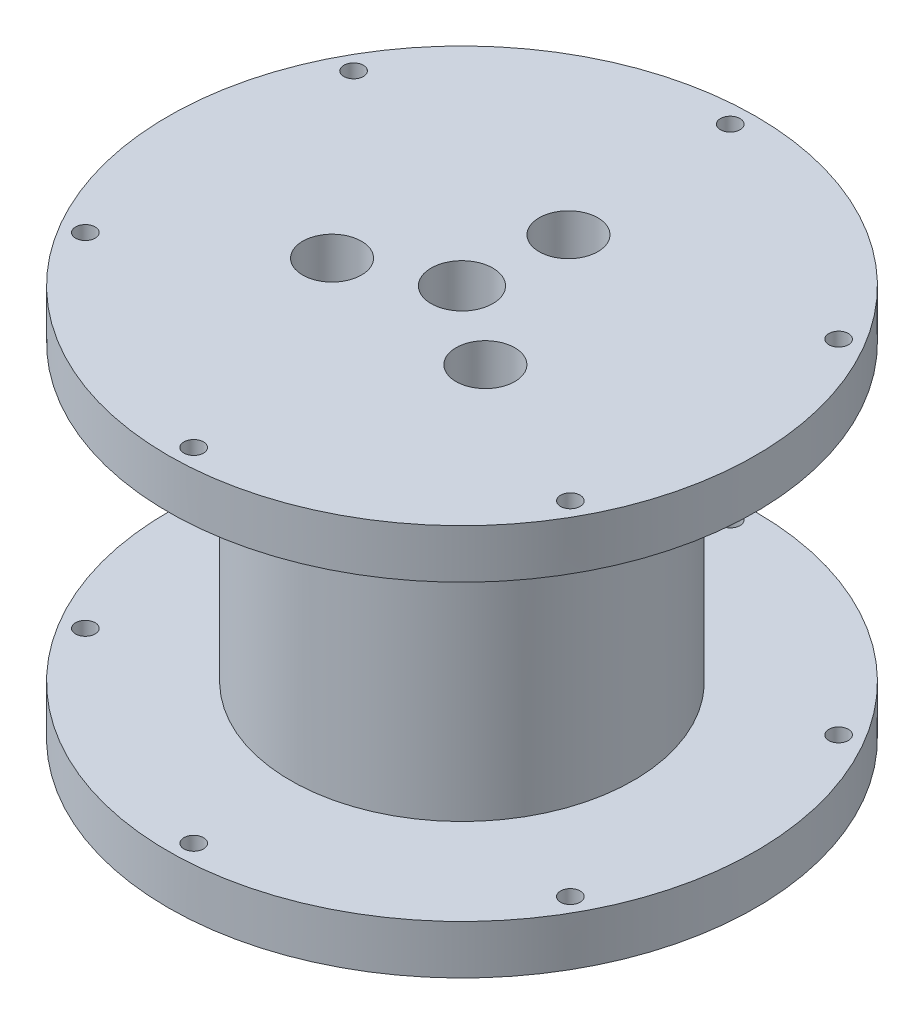
from build123d import *

# Parameters (mm, degrees)
SKETCH1_R               = 30
BOSS_EXTRUDE1_DEPTH     = 40
CUT_EXTRUDE1_START      = -5
SKETCH2_OUTSIDE_W       = 80.762
SKETCH2_OUTSIDE_H       = 80.762
SKETCH2_OUTSIDE_R       = 17.5
CUT_EXTRUDE1_DEPTH      = 30
SKETCH3_R               = 3.15
CUT_EXTRUDE2_DEPTH      = 59.309518948
CUT_EXTRUDE3_DEPTH      = 59.309518948
CUT_EXTRUDE4_REACH      = 60
CUT_EXTRUDE4_START      = 3
SKETCH5_R               = 2
CUT_EXTRUDE5_DEPTH      = 7.5
FILLET1_R               = 2
CUT_EXTRUDE6_DEPTH      = 59.309518948
CUT_EXTRUDE6_DEPTH_BACK = 59.309518948


with BuildPart() as part:
    # Sketch1 → Boss-Extrude1 (new body)
    with BuildSketch(Plane(origin=(0, 0, 0), x_dir=(1, 0, 0), z_dir=(0, 1, 0))):
        with Locations(Location((0, 0, 0), (0, 0, 270))):
            Circle(SKETCH1_R)
    extrude(amount=BOSS_EXTRUDE1_DEPTH)

    # Sketch2 outside → Cut-Extrude1 (cut)
    with BuildSketch(Plane.XZ.offset(CUT_EXTRUDE1_START)):
        Rectangle(SKETCH2_OUTSIDE_W, SKETCH2_OUTSIDE_H)
        with Locations(Location((0, 0, 0), (0, 0, 270))):
            Circle(SKETCH2_OUTSIDE_R, mode=Mode.SUBTRACT)
    extrude(amount=-CUT_EXTRUDE1_DEPTH, mode=Mode.SUBTRACT)

    # Sketch3 → Cut-Extrude2 (cut, through all)
    with BuildSketch(Plane.XZ):
        with Locations(Location((0, 0, 0), (0, 0, 270))):
            Circle(SKETCH3_R)
    extrude(amount=-CUT_EXTRUDE2_DEPTH, mode=Mode.SUBTRACT)

    # Sketch4 → Cut-Extrude3 (cut, through all)
    with BuildSketch(Plane.XZ):
        with BuildLine():
            ThreePointArc((3.905730858, -9.682213924), (0.642886859, -6.970415804), (-2.06891126, -10.233259803))
            Line((-2.06891126, -10.233259803), (3.905730858, -9.682213924))
        make_face()
        with BuildLine():
            Line((3.905730858, -9.682213924), (-2.06891126, -10.233259803))
            ThreePointArc((-2.06891126, -10.233259803), (1.056317055, -12.954565452), (3.918409799, -9.957736863))
            ThreePointArc((3.918409799, -9.957736863), (3.915238387, -9.819829607), (3.905730858, -9.682213924))
        make_face()
        with BuildLine():
            ThreePointArc((6.432177794, 8.223569105), (5.715113732, 4.041964254), (9.896718583, 3.324900192))
            Line((9.896718583, 3.324900192), (6.432177794, 8.223569105))
        make_face()
        with BuildLine():
            Line((6.432177794, 8.223569105), (9.896718583, 3.324900192))
            ThreePointArc((9.896718583, 3.324900192), (10.828731505, 4.395251542), (11.164448189, 5.774234649))
            ThreePointArc((11.164448189, 5.774234649), (9.543431295, 8.438517965), (6.432177794, 8.223569105))
        make_face()
        with BuildLine():
            ThreePointArc((-7.827807323, 6.908359611), (-11.807715384, 5.438552879), (-10.337908652, 1.458644819))
            Line((-10.337908652, 1.458644819), (-7.827807323, 6.908359611))
        make_face()
        with BuildLine():
            Line((-7.827807323, 6.908359611), (-10.337908652, 1.458644819))
            ThreePointArc((-10.337908652, 1.458644819), (-7.465012505, 1.657126155), (-6.082857987, 4.183502215))
            ThreePointArc((-6.082857987, 4.183502215), (-6.556481927, 5.801347697), (-7.827807323, 6.908359611))
        make_face()
    extrude(amount=-CUT_EXTRUDE3_DEPTH, mode=Mode.SUBTRACT)

    # Sketch5 → Cut-Extrude4 (cut, up to next)
    with BuildSketch(Plane(origin=(0, 5, 0), x_dir=(1, 0, 0), z_dir=(0, 1, 0)).offset(CUT_EXTRUDE4_START), mode=Mode.PRIVATE) as cut_extrude4_sk1:
        with Locations(Location((-15.339737127, 8.422734999, 0), (0, 0, 270))):
            Circle(SKETCH5_R)
    cut_extrude4_tool1 = extrude(cut_extrude4_sk1.sketch, amount=-CUT_EXTRUDE4_REACH, mode=Mode.PRIVATE) & part.part
    add(cut_extrude4_tool1.solids().sort_by_distance((-15.339737, 8, -8.422735))[0], mode=Mode.SUBTRACT)

    # Sketch6 → Cut-Extrude5 (cut)
    with BuildSketch(Plane.XZ):
        Polygon((-6.062177826, 0), (-3.031088913, -5.25), (3.031088913, -5.25), (6.062177826, 0), (3.031088913, 5.25), (-3.031088913, 5.25), align=None)
    extrude(amount=-CUT_EXTRUDE5_DEPTH, mode=Mode.SUBTRACT)

    # Fillet1
    fillet1_edges = [part.edges().sort_by_distance(p)[0] for p in [
        (-13.417435738, 8, -7.870686661),
    ]]
    fillet(fillet1_edges, radius=FILLET1_R - 0.0001)  # a hair under: the kernel refuses the full size

    # Sketch7 → Cut-Extrude6 (cut, two sides: drawn at the far end of the back side and taken through both)
    with BuildSketch(Plane(origin=(0, 0, 0), x_dir=(-1, 0, 0), z_dir=(0, -1, 0)).offset(-CUT_EXTRUDE6_DEPTH_BACK)):
        with BuildLine():
            Line((-24.522118485, -12.47660631), (-24.543579404, -13.476375998))
            Line((-24.543579404, -13.476375998), (-23.688483916, -13.994846544))
            ThreePointArc((-23.688483916, -13.994846544), (-23.580486602, -13.745545566), (-23.543579404, -13.476375998))
            ThreePointArc((-23.543579404, -13.476375998), (-23.82892532, -12.77689795), (-24.522118485, -12.47660631))
        make_face()
        with BuildLine():
            Line((-23.688483916, -13.994846544), (-24.543579404, -13.476375998))
            Line((-24.543579404, -13.476375998), (-24.522118485, -12.47660631))
            ThreePointArc((-24.522118485, -12.47660631), (-25.420135811, -13.957675141), (-23.688483916, -13.994846544))
        make_face()
        with BuildLine():
            ThreePointArc((0.275650671, -27.51225212), (-0.579444817, -26.993781575), (-1.456001224, -27.475080718))
            Line((-1.456001224, -27.475080718), (-0.600905736, -27.993551263))
            Line((-0.600905736, -27.993551263), (0.275650671, -27.51225212))
        make_face()
        with BuildLine():
            Line((-0.600905736, -27.993551263), (-1.456001224, -27.475080718))
            ThreePointArc((-1.456001224, -27.475080718), (-0.870075304, -28.956644064), (0.399094264, -27.993551263))
            ThreePointArc((0.399094264, -27.993551263), (0.36774188, -27.745112545), (0.275650671, -27.51225212))
            Line((0.275650671, -27.51225212), (-0.600905736, -27.993551263))
        make_face()
        with BuildLine():
            ThreePointArc((23.964134587, -13.517405576), (23.087578179, -13.998704719), (23.06611726, -14.998474407))
            Line((23.06611726, -14.998474407), (23.942673667, -14.517175264))
            Line((23.942673667, -14.517175264), (23.964134587, -13.517405576))
        make_face()
        with BuildLine():
            Line((23.942673667, -14.517175264), (23.06611726, -14.998474407))
            ThreePointArc((23.06611726, -14.998474407), (24.191112385, -15.48582288), (24.942673667, -14.517175264))
            ThreePointArc((24.942673667, -14.517175264), (24.657327751, -13.817697216), (23.964134587, -13.517405576))
            Line((23.964134587, -13.517405576), (23.942673667, -14.517175264))
        make_face()
        with BuildLine():
            ThreePointArc((23.688483916, 13.994846544), (23.667022996, 12.995076856), (24.522118485, 12.47660631))
            Line((24.522118485, 12.47660631), (24.543579404, 13.476375998))
            Line((24.543579404, 13.476375998), (23.688483916, 13.994846544))
        make_face()
        with BuildLine():
            Line((24.543579404, 13.476375998), (24.522118485, 12.47660631))
            ThreePointArc((24.522118485, 12.47660631), (25.243057452, 12.761721915), (25.543579404, 13.476375998))
            ThreePointArc((25.543579404, 13.476375998), (24.812748971, 14.4394688), (23.688483916, 13.994846544))
            Line((23.688483916, 13.994846544), (24.543579404, 13.476375998))
        make_face()
        with BuildLine():
            ThreePointArc((1.600905736, 27.993551263), (0.352467019, 28.962198878), (-0.275650671, 27.51225212))
            Line((-0.275650671, 27.51225212), (0.600905736, 27.993551263))
            Line((0.600905736, 27.993551263), (1.456001224, 27.475080718))
            ThreePointArc((1.456001224, 27.475080718), (1.563998538, 27.724381695), (1.600905736, 27.993551263))
        make_face()
        with BuildLine():
            Line((0.600905736, 27.993551263), (-0.275650671, 27.51225212))
            ThreePointArc((-0.275650671, 27.51225212), (0.579444817, 26.993781575), (1.456001224, 27.475080718))
            Line((1.456001224, 27.475080718), (0.600905736, 27.993551263))
        make_face()
        with BuildLine():
            ThreePointArc((-23.06611726, 14.998474407), (-24.797769156, 15.035645809), (-23.964134587, 13.517405576))
            Line((-23.964134587, 13.517405576), (-23.942673667, 14.517175264))
            Line((-23.942673667, 14.517175264), (-23.06611726, 14.998474407))
        make_face()
        with BuildLine():
            Line((-23.942673667, 14.517175264), (-23.964134587, 13.517405576))
            ThreePointArc((-23.964134587, 13.517405576), (-23.243195619, 13.80252118), (-22.942673667, 14.517175264))
            ThreePointArc((-22.942673667, 14.517175264), (-22.974026052, 14.765613982), (-23.06611726, 14.998474407))
            Line((-23.06611726, 14.998474407), (-23.942673667, 14.517175264))
        make_face()
    extrude(amount=CUT_EXTRUDE6_DEPTH + CUT_EXTRUDE6_DEPTH_BACK, mode=Mode.SUBTRACT)


solid = part.part
